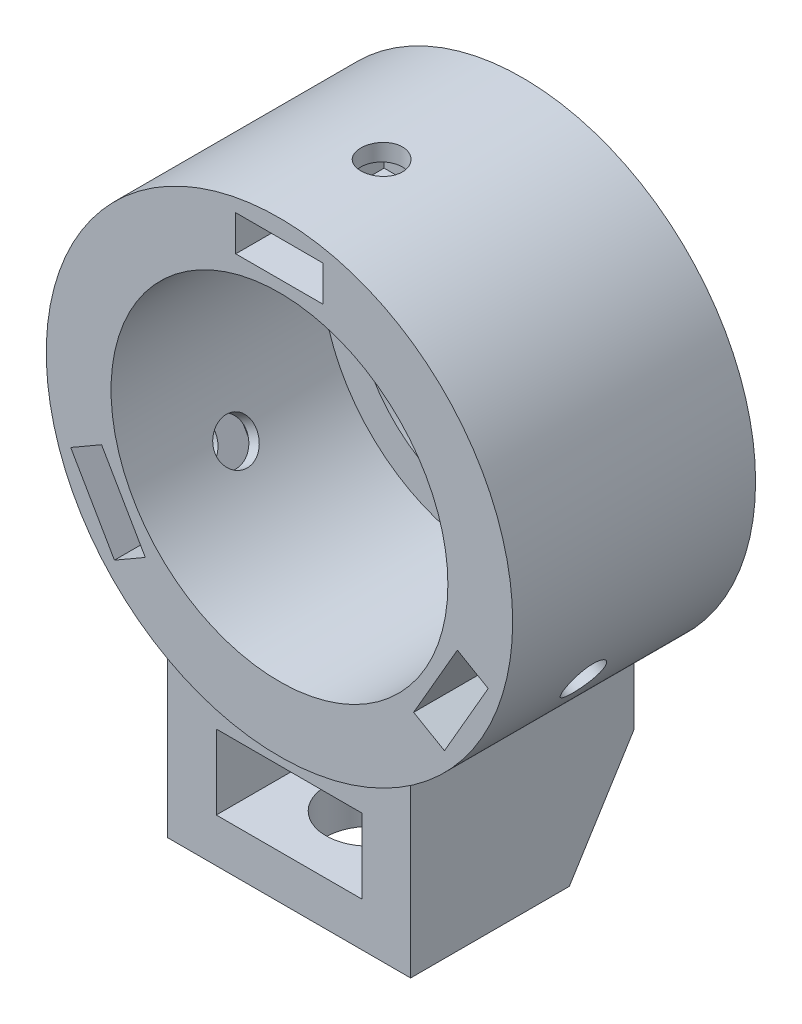
from build123d import *

# Parameters (mm, degrees)
SKETCH1_R                   = 18.288
BOSS_EXTRUDE1_DEPTH         = 19.05
SKETCH3_R                   = 13.208
CUT_EXTRUDE1_DEPTH          = 16.51
CUT_EXTRUDE2_REACH          = 32.684
SKETCH6_R                   = 10.668
SKETCH10_W                  = 6.858
SKETCH10_H                  = 2.794
CUT_EXTRUDE3_DEPTH          = 11.63828
CIRPATTERN1_COUNT           = 3
CIRPATTERN2_COUNT           = 3
SKETCH15_W                  = 19.05
SKETCH15_H                  = 17.526
BOSS_EXTRUDE3_DEPTH         = 15.24
SKETCH16_W                  = 11.43
SKETCH16_H                  = 5.842
CUT_EXTRUDE4_DEPTH          = 39.824629185
CHAMFER1_SIZE               = 8.129699408
CHAMFER1_SIZE_2             = 5.08
F_1_4_CLEARANCE_HOLE1_D     = 6.7564
F_1_4_CLEARANCE_HOLE1_DEPTH = 3.448428068


with BuildPart() as part:
    # Sketch1 → Boss-Extrude1 (new body)
    with BuildSketch(Plane.XY):
        with Locations(Location((0, 0, 0), (0, 0, 180))):
            Circle(SKETCH1_R)
    extrude(amount=BOSS_EXTRUDE1_DEPTH)

    # Sketch3 → Cut-Extrude1 (cut)
    with BuildSketch(Plane.XY.offset(19.05)):
        Circle(SKETCH3_R)
    extrude(amount=-CUT_EXTRUDE1_DEPTH, mode=Mode.SUBTRACT)

    # Sketch6 → Cut-Extrude2 (cut, up to next)
    with BuildSketch(Plane.XY.offset(2.54), mode=Mode.PRIVATE) as cut_extrude2_sk1:
        Circle(SKETCH6_R)
    cut_extrude2_tool1 = extrude(cut_extrude2_sk1.sketch, amount=-CUT_EXTRUDE2_REACH, mode=Mode.PRIVATE) & part.part
    add(cut_extrude2_tool1.solids().sort_by_distance((0, 0, 2.54))[0], mode=Mode.SUBTRACT)

    # Sketch10 → Cut-Extrude3 (cut)
    with BuildSketch(Plane.XY.offset(19.05)):
        with Locations((0, 15.526400014)):
            Rectangle(SKETCH10_W, SKETCH10_H)
    cut_extrude3 = extrude(amount=-CUT_EXTRUDE3_DEPTH, mode=Mode.SUBTRACT)

    # CirPattern1: Cut-Extrude3 ×3 about axis
    cirpattern1_axis = Axis((0, 0, 0), (0, 0, 1))
    for i in range(1, CIRPATTERN1_COUNT):
        add(cut_extrude3.rotate(cirpattern1_axis, i * 360 / CIRPATTERN1_COUNT), mode=Mode.SUBTRACT)

    # Sketch13 → #4 Clearance Hole1 (revolve, cut)
    with BuildSketch(Plane(origin=(0, 10.16, 11.039220548), x_dir=(0, 0, -1), z_dir=(1, 0, 0))):
        Polygon((0, 0), (0, 13.680574487), (1.63195, 12.7), (1.63195, 0), align=None)
    f_4_clearance_hole1 = revolve(axis=Axis((0, 3.81, 11.039220548), (0, 1, 0)), mode=Mode.SUBTRACT)

    # CirPattern2: #4 Clearance Hole1 ×3 about axis
    cirpattern2_axis = Axis((0, 0, 19.05), (0, 0, -1))
    for i in range(1, CIRPATTERN2_COUNT):
        add(f_4_clearance_hole1.rotate(cirpattern2_axis, i * 360 / CIRPATTERN2_COUNT), mode=Mode.SUBTRACT)

    # Sketch15 → Boss-Extrude3 (add)
    with BuildSketch(Plane(origin=(0, -13.716, 0), x_dir=(1, 0, 0), z_dir=(0, 1, 0))):
        with Locations((0, -9.525)):
            Rectangle(SKETCH15_W, SKETCH15_H)
    extrude(amount=-BOSS_EXTRUDE3_DEPTH)

    # Sketch16 → Cut-Extrude4 (cut, through all)
    with BuildSketch(Plane.XY.offset(18.288)):
        with Locations((0, -22.586571932)):
            Rectangle(SKETCH16_W, SKETCH16_H)
    extrude(amount=-CUT_EXTRUDE4_DEPTH, mode=Mode.SUBTRACT)

    # Chamfer1
    # the kernel refuses this chamfer: 8.129699408, 5.08 mm, written as the material it takes off along each edge
    with BuildSketch(Plane(origin=(-30.543101737, -28.956, 0.762), x_dir=(0, 0.9997899140358644, -0.020497019104217945), z_dir=(1, 0, 0))) as chamfer1_piece_1:
        Polygon((CHAMFER1_SIZE * 0.999789913978, CHAMFER1_SIZE * 0.020497019103), (-CHAMFER1_SIZE_2 * 0.0204970191042, CHAMFER1_SIZE_2 * 0.999789914036), (0, 0), align=None)
    extrude(amount=61.086203475, mode=Mode.SUBTRACT)

    # 1/4 Clearance Hole1
    with Locations(Plane(origin=(0, -28.956, 0), x_dir=(-1, 0, 0), z_dir=(0, -1, 0))):
        with Locations((0, -12.021417661)):
            Hole(F_1_4_CLEARANCE_HOLE1_D / 2, depth=F_1_4_CLEARANCE_HOLE1_DEPTH)


solid = part.part
